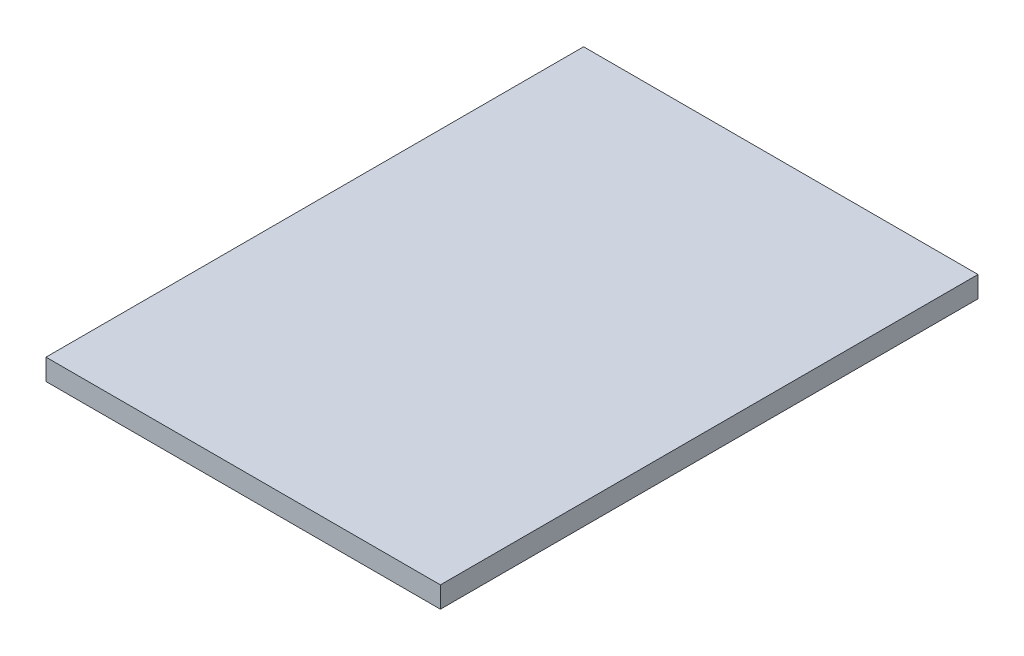
from build123d import *

# Parameters (mm, degrees)
SKETCH1_W           = 168
SKETCH1_H           = 229
BOSS_EXTRUDE1_DEPTH = 9


with BuildPart() as part:
    # Sketch1 → Boss-Extrude1 (new body)
    with BuildSketch(Plane(origin=(0, 0, 0), x_dir=(1, 0, 0), z_dir=(0, 1, 0))):
        Rectangle(SKETCH1_W, SKETCH1_H)
    extrude(amount=BOSS_EXTRUDE1_DEPTH)


solid = part.part
